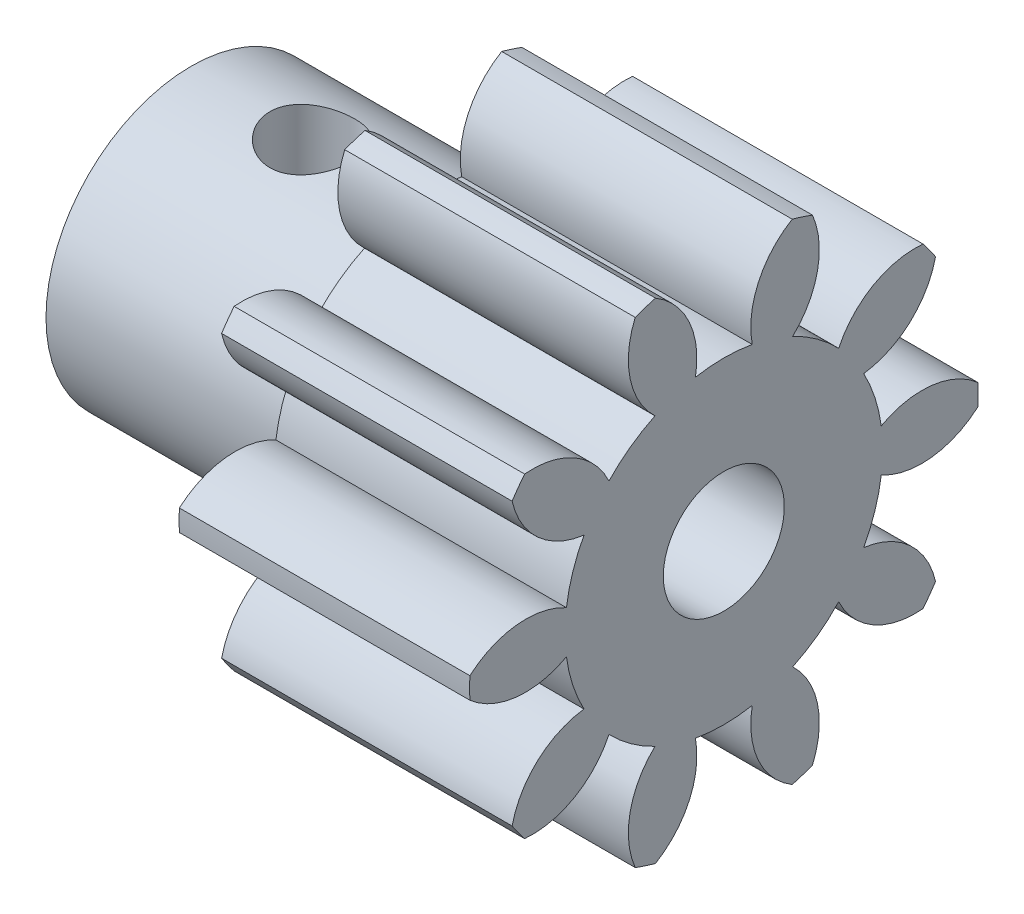
from build123d import *

# Parameters (mm, degrees)
BASPROSKE_W         = 12
BASPROSKE_H         = 10.5
TOOTHCUT_DEPTH      = 20.091883092
TEETHCUTS_COUNT     = 10
TEETHCUTS_ANGLE     = 324
BORSKE_R            = 2.5
BORE_DEPTH          = 50.0000508
SKETCH2_R           = 6
BOSS_EXTRUDE1_DEPTH = 10
SKETCH4_R           = 1.75
CUT_EXTRUDE1_DEPTH  = 10


with BuildPart() as part:
    # BasProSke → Base-Revolve (revolve)
    with BuildSketch(Plane(origin=(0, 0, 0), x_dir=(1, 0, 0), z_dir=(0, 1, 0))):
        with Locations((6, 5.25)):
            Rectangle(BASPROSKE_W, BASPROSKE_H)
    revolve(axis=Axis((-10, 0, 0), (1, 0, 0)))

    # TooCutSke → ToothCut (cut, through all)
    with BuildSketch(Plane(origin=(0, 0, 0), x_dir=(0, 0, -1), z_dir=(1, 0, 0))):
        with BuildLine():
            ThreePointArc((1.173901537, 6.455636098), (0, 6.5615), (-1.173901537, 6.455636098))
            ThreePointArc((-1.173901537, 6.455636098), (-1.430021039, 8.560346018), (-2.854248526, 10.131007379))
            ThreePointArc((-2.854248526, 10.131007379), (0, 10.5254), (2.854248526, 10.131007379))
            ThreePointArc((2.854248526, 10.131007379), (1.430021039, 8.560346018), (1.173901537, 6.455636098))
        make_face()
    toothcut = extrude(amount=TOOTHCUT_DEPTH, mode=Mode.SUBTRACT)

    # TeethCuts: ToothCut ×10 about axis
    teethcuts_axis = Axis((-10, 0, 0), (1, 0, 0))
    for i in range(1, TEETHCUTS_COUNT):
        add(toothcut.rotate(teethcuts_axis, i * TEETHCUTS_ANGLE / (TEETHCUTS_COUNT - 1)), mode=Mode.SUBTRACT)

    # BorSke → Bore (cut, symmetric)
    with BuildSketch(Plane(origin=(0, 0, 0), x_dir=(0, 0, -1), z_dir=(1, 0, 0))):
        Circle(BORSKE_R)
    extrude(amount=BORE_DEPTH, both=True, mode=Mode.SUBTRACT)

    # Sketch2 → Boss-Extrude1 (add)
    with BuildSketch(Plane.ZY):
        Circle(SKETCH2_R)
        with BuildLine():
            ThreePointArc((1.58113883, 2.25), (0, -2.75), (-1.58113883, 2.25))
            Line((-1.58113883, 2.25), (1.58113883, 2.25))
        make_face(mode=Mode.SUBTRACT)
    extrude(amount=BOSS_EXTRUDE1_DEPTH)

    # Sketch4 → Cut-Extrude1 (cut)
    with BuildSketch(Plane(origin=(0, 0, 0), x_dir=(1, 0, 0), z_dir=(0, 1, 0))):
        with Locations((-5, 0)):
            Circle(SKETCH4_R)
    extrude(amount=CUT_EXTRUDE1_DEPTH, mode=Mode.SUBTRACT)


solid = part.part
